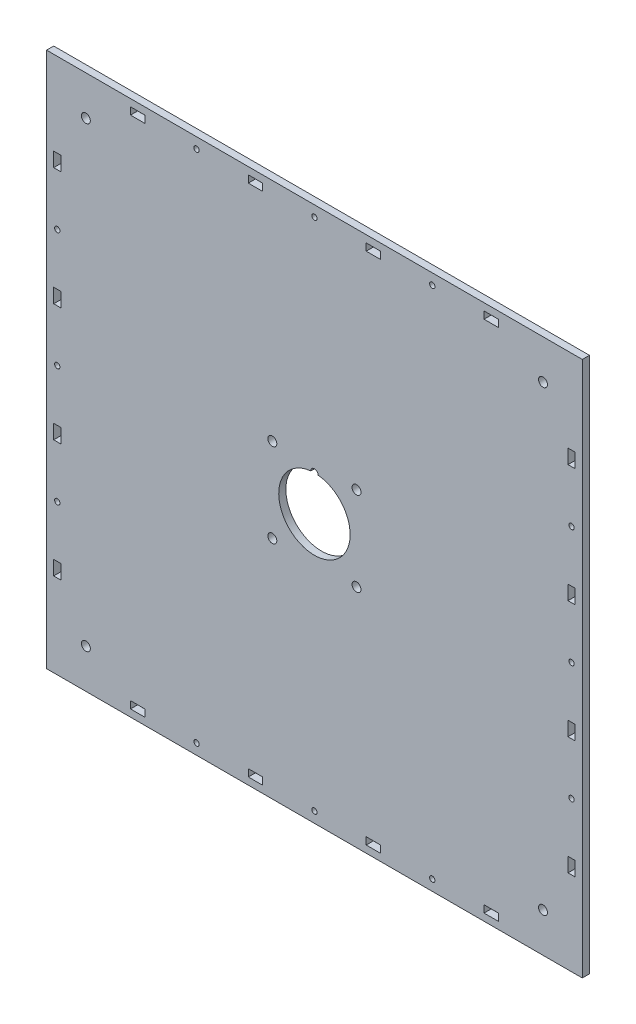
from build123d import *

# Parameters (mm, degrees)
SKETCH_1_R          = 20
SKETCH_1_R_2        = 2.5
EXTRUDE_1_DEPTH     = 4
SKETCH_2_R          = 2
CUT_EXTRUDE_1_DEPTH = 4
SKETCH_3_R          = 1.5
SKETCH_3_W          = 8.03
SKETCH_3_H          = 4.03
SKETCH_3_W_2        = 4.03
SKETCH_3_H_2        = 8.03
CUT_EXTRUDE_2_DEPTH = 4
SKETCH_5_R          = 2.5
CUT_EXTRUDE_4_DEPTH = 10


with BuildPart() as part:
    # 草图1 → 凸台-拉伸1 (new body)
    with BuildSketch(Plane.XY):
        Polygon((151.457142857, -41.187142857), (151.457142857, 108.812857143), (-148.542857143, 108.812857143), (-148.542857143, -191.187142857), (151.457142857, -191.187142857), align=None)
        with Locations((1.457142857, -41.187142857)):
            Circle(SKETCH_1_R, mode=Mode.SUBTRACT)
        with Locations((25.027142857, -17.617142857)):
            Circle(SKETCH_1_R_2, mode=Mode.SUBTRACT)
        with Locations((25.027142857, -64.757142857)):
            Circle(SKETCH_1_R_2, mode=Mode.SUBTRACT)
        with Locations((-22.112857143, -64.757142857)):
            Circle(SKETCH_1_R_2, mode=Mode.SUBTRACT)
        with Locations((-22.112857143, -17.617142857)):
            Circle(SKETCH_1_R_2, mode=Mode.SUBTRACT)
    extrude(amount=EXTRUDE_1_DEPTH)

    # 草图2 → 切除-拉伸1 (cut)
    with BuildSketch(Plane.XY.offset(4)):
        with Locations((1.457142857, -21.187142857)):
            Circle(SKETCH_2_R)
    extrude(amount=-CUT_EXTRUDE_1_DEPTH, mode=Mode.SUBTRACT)

    # 草图3 → 切除-拉伸2 (cut)
    with BuildSketch(Plane.XY.offset(4)):
        with Locations((1.457142857, -185.187142857)):
            Circle(SKETCH_3_R)
        with Locations((67.457142857, -185.187142857)):
            Circle(SKETCH_3_R)
        with Locations((-64.542857143, -185.187142857)):
            Circle(SKETCH_3_R)
        with Locations((-142.542857143, 24.812857143)):
            Circle(SKETCH_3_R)
        with Locations((-142.542857143, -41.187142857)):
            Circle(SKETCH_3_R)
        with Locations((-142.542857143, -107.187142857)):
            Circle(SKETCH_3_R)
        with Locations((67.457142857, 102.812857143)):
            Circle(SKETCH_3_R)
        with Locations((1.457142857, 102.812857143)):
            Circle(SKETCH_3_R)
        with Locations((-64.542857143, 102.812857143)):
            Circle(SKETCH_3_R)
        with Locations((145.457142857, -107.187142857)):
            Circle(SKETCH_3_R)
        with Locations((145.457142857, -41.187142857)):
            Circle(SKETCH_3_R)
        with Locations((145.457142857, 24.812857143)):
            Circle(SKETCH_3_R)
        with Locations((100.457142857, -185.187142857)):
            Rectangle(SKETCH_3_W, SKETCH_3_H)
        with Locations((34.457142857, -185.187142857)):
            Rectangle(SKETCH_3_W, SKETCH_3_H)
        with Locations((-31.542857143, -185.187142857)):
            Rectangle(SKETCH_3_W, SKETCH_3_H)
        with Locations((-97.542857143, -185.187142857)):
            Rectangle(SKETCH_3_W, SKETCH_3_H)
        with Locations((-142.542857143, 57.812857143)):
            Rectangle(SKETCH_3_W_2, SKETCH_3_H_2)
        with Locations((-142.542857143, -8.187142857)):
            Rectangle(SKETCH_3_W_2, SKETCH_3_H_2)
        with Locations((-142.542857143, -74.187142857)):
            Rectangle(SKETCH_3_W_2, SKETCH_3_H_2)
        with Locations((-142.542857143, -140.187142857)):
            Rectangle(SKETCH_3_W_2, SKETCH_3_H_2)
        with Locations((100.457142857, 102.812857143)):
            Rectangle(SKETCH_3_W, SKETCH_3_H)
        with Locations((34.457142857, 102.812857143)):
            Rectangle(SKETCH_3_W, SKETCH_3_H)
        with Locations((-31.542857143, 102.812857143)):
            Rectangle(SKETCH_3_W, SKETCH_3_H)
        with Locations((-97.542857143, 102.812857143)):
            Rectangle(SKETCH_3_W, SKETCH_3_H)
        with Locations((145.457142857, -140.187142857)):
            Rectangle(SKETCH_3_W_2, SKETCH_3_H_2)
        with Locations((145.457142857, -74.187142857)):
            Rectangle(SKETCH_3_W_2, SKETCH_3_H_2)
        with Locations((145.457142857, -8.187142857)):
            Rectangle(SKETCH_3_W_2, SKETCH_3_H_2)
        with Locations((145.457142857, 57.812857143)):
            Rectangle(SKETCH_3_W_2, SKETCH_3_H_2)
    extrude(amount=-CUT_EXTRUDE_2_DEPTH, mode=Mode.SUBTRACT)

    # 草图5 → 切除-拉伸4 (cut)
    with BuildSketch(Plane.XY.offset(4)):
        with Locations((-126.542857143, 86.812857143)):
            Circle(SKETCH_5_R)
        with Locations((129.457142857, 86.812857143)):
            Circle(SKETCH_5_R)
        with Locations((129.457142857, -169.187142857)):
            Circle(SKETCH_5_R)
        with Locations((-126.542857143, -169.187142857)):
            Circle(SKETCH_5_R)
    extrude(amount=-CUT_EXTRUDE_4_DEPTH, mode=Mode.SUBTRACT)


solid = part.part
